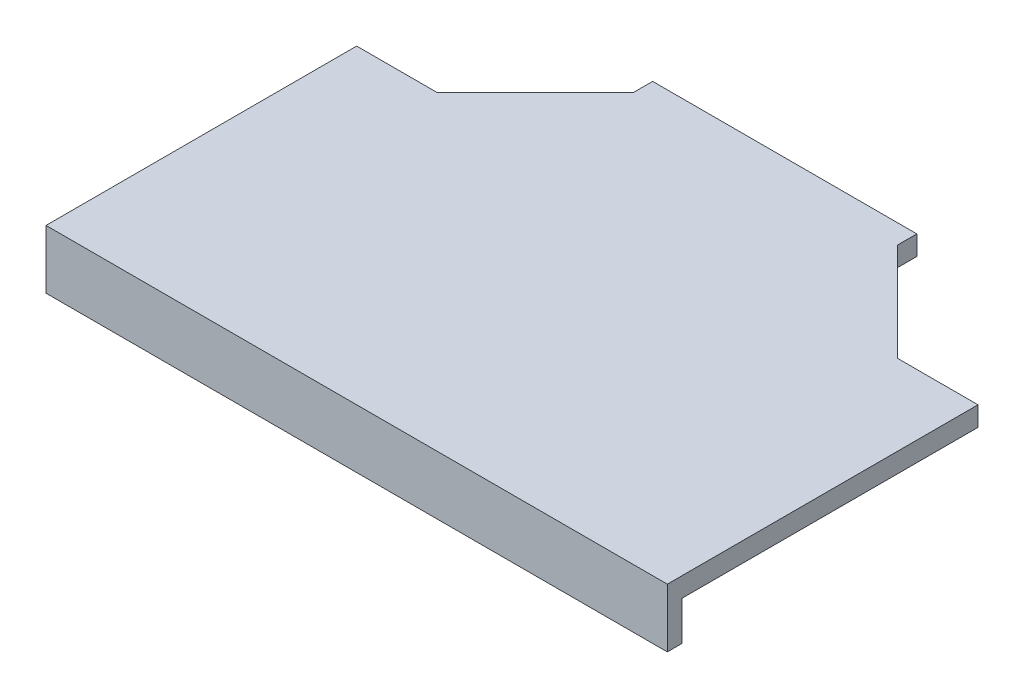
from build123d import *

# Parameters (mm, degrees)
SKETCH1_W           = 27
SKETCH1_H           = 10.8
BOSS_EXTRUDE1_DEPTH = 2
SKETCH2_W           = 27
SKETCH2_H           = 14
BOSS_EXTRUDE2_DEPTH = 2
SKETCH4_W           = 27
SKETCH4_H           = 12.8
BOSS_EXTRUDE3_DEPTH = 4
SKETCH6_W           = 11.173913912
SKETCH6_H           = 4.273360264
CUT_EXTRUDE1_DEPTH  = 24.685649664
SKETCH7_R           = 1.05
CUT_EXTRUDE2_DEPTH  = 20.519477452
SKETCH8_W           = 4.220493503
SKETCH8_H           = 6.690229829
CUT_EXTRUDE3_DEPTH  = 4
SKETCH9_W           = 4.8014854
SKETCH9_H           = 5.143985731
CUT_EXTRUDE4_DEPTH  = 4
SKETCH10_W          = 63.5
SKETCH10_H          = 31.75
BOSS_EXTRUDE5_DEPTH = 2
SKETCH11_R          = 7.036678993
SKETCH11_W          = 2.657689319
SKETCH11_H          = 6.526639736
CUT_EXTRUDE5_DEPTH  = 4
CHAMFER1_SIZE       = 10
SKETCH12_W          = 63.5
SKETCH12_H          = 1.5
BOSS_EXTRUDE6_DEPTH = 4


with BuildPart() as part:
    # Sketch1 → Boss-Extrude1 (new body)
    with BuildSketch(Plane.XY):
        Rectangle(SKETCH1_W, SKETCH1_H)
    extrude(amount=BOSS_EXTRUDE1_DEPTH)

    # Sketch2 → Boss-Extrude2 (add)
    with BuildSketch(Plane(origin=(0, 5.4, 0), x_dir=(1, 0, 0), z_dir=(0, 1, 0))):
        with Locations((0, 5)):
            Rectangle(SKETCH2_W, SKETCH2_H)
    extrude(amount=BOSS_EXTRUDE2_DEPTH)

    # Sketch4 → Boss-Extrude3 (add)
    with BuildSketch(Plane.XY.offset(2)):
        with Locations((0, 1)):
            Rectangle(SKETCH4_W, SKETCH4_H)
    extrude(amount=BOSS_EXTRUDE3_DEPTH)

    # Sketch6 → Cut-Extrude1 (cut, through all)
    with BuildSketch(Plane.XY.offset(6)):
        with Locations((7.913043044, -3.263319868)):
            Rectangle(SKETCH6_W, SKETCH6_H)
    extrude(amount=-CUT_EXTRUDE1_DEPTH, mode=Mode.SUBTRACT)

    # Sketch7 → Cut-Extrude2 (cut, through all)
    with BuildSketch(Plane(origin=(0, 0, 0), x_dir=(-1, 0, 0), z_dir=(0, 0, -1))):
        with Locations((11.7, -3.3)):
            Circle(SKETCH7_R)
        with Locations((-11.7, 3.3)):
            Circle(SKETCH7_R)
    extrude(amount=-CUT_EXTRUDE2_DEPTH, mode=Mode.SUBTRACT)

    # Sketch8 → Cut-Extrude3 (cut)
    with BuildSketch(Plane.XY.offset(6)):
        with Locations((11.389753248, 2.218475179)):
            Rectangle(SKETCH8_W, SKETCH8_H)
    extrude(amount=-CUT_EXTRUDE3_DEPTH, mode=Mode.SUBTRACT)

    # Sketch9 → Cut-Extrude4 (cut)
    with BuildSketch(Plane.XY.offset(6)):
        with Locations((-11.0992573, -2.828007134)):
            Rectangle(SKETCH9_W, SKETCH9_H)
    extrude(amount=-CUT_EXTRUDE4_DEPTH, mode=Mode.SUBTRACT)

    # Sketch10 → Boss-Extrude5 (add)
    with BuildSketch(Plane(origin=(0, 7.4, 0), x_dir=(1, 0, 0), z_dir=(0, 1, 0))):
        with Locations((0, -15.875)):
            Rectangle(SKETCH10_W, SKETCH10_H)
    extrude(amount=-BOSS_EXTRUDE5_DEPTH)

    # Sketch11 → Cut-Extrude5 (cut)
    with BuildSketch(Plane.XY.offset(2)):
        with Locations((-13.5, -5.4)):
            Circle(SKETCH11_R)
        with Locations((7.950661838, 2.136680132)):
            Rectangle(SKETCH11_W, SKETCH11_H)
    extrude(amount=CUT_EXTRUDE5_DEPTH, mode=Mode.SUBTRACT)

    # Chamfer1
    # the kernel refuses this chamfer: 10 mm, written as the material it adds along each edge
    with BuildSketch(Plane(origin=(-13.5, 5.4, 0), x_dir=(-0.9996219169112968, 0, 0.02749587661058648), z_dir=(0, 1, 0))) as chamfer1_piece_1:
        Polygon((CHAMFER1_SIZE * 0.999621916911, -CHAMFER1_SIZE * 0.0274958766106), (-CHAMFER1_SIZE * 0.0274958766106, -CHAMFER1_SIZE * 0.999621916911), (0, 0), align=None)
    extrude(amount=2)
    with BuildSketch(Plane(origin=(13.5, 7.4, 0), x_dir=(-0.027495876610586147, 0, -0.9996219169112968), z_dir=(0, -1, 0))) as chamfer1_piece_2:
        Polygon((CHAMFER1_SIZE * 0.999621916911, CHAMFER1_SIZE * 0.0274958766106), (-CHAMFER1_SIZE * 0.0274958766106, CHAMFER1_SIZE * 0.999621916911), (0, 0), align=None)
    extrude(amount=2)

    # Sketch12 → Boss-Extrude6 (add)
    with BuildSketch(Plane.XZ.offset(-5.4)):
        with Locations((0, 31)):
            Rectangle(SKETCH12_W, SKETCH12_H)
    extrude(amount=BOSS_EXTRUDE6_DEPTH)


solid = part.part
